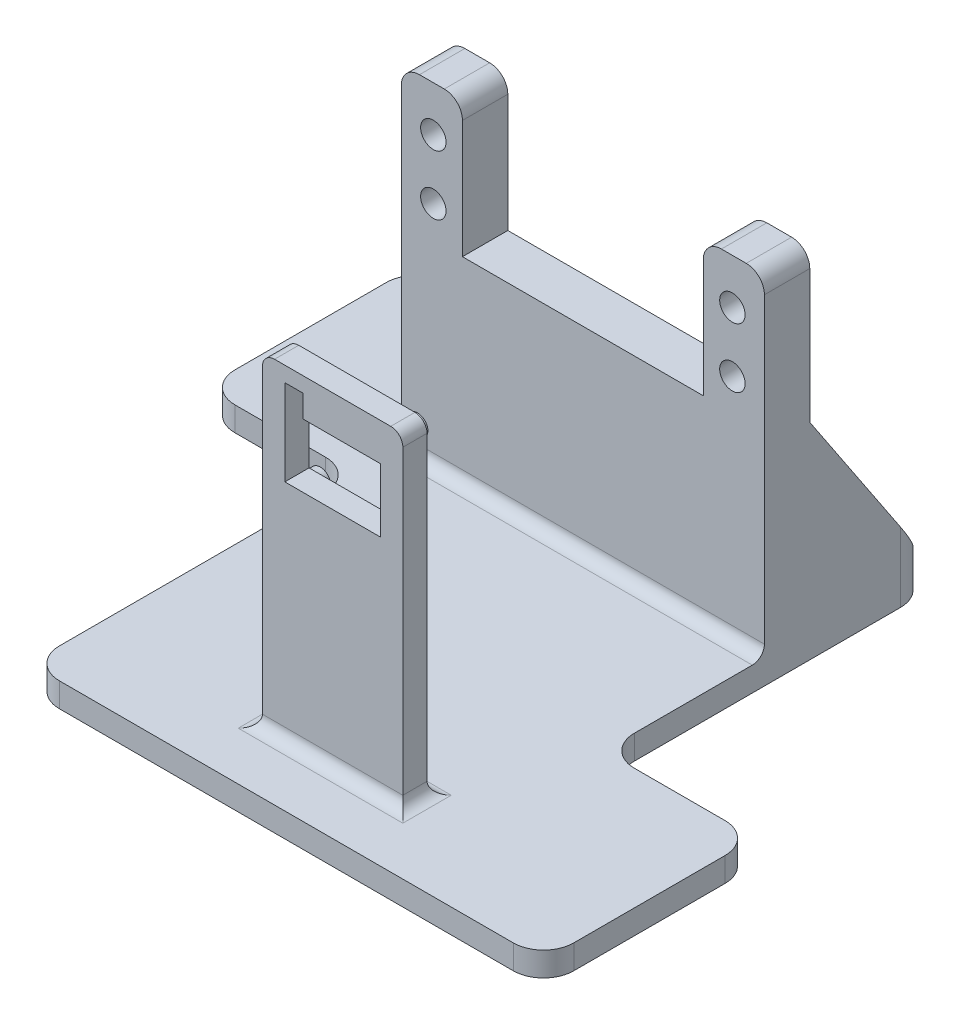
from build123d import *

# Parameters (mm, degrees)
SKETCH2_W                = 60
SKETCH2_H                = 55
BOSS_EXTRUDE1_DEPTH      = 7.5
SKETCH3_W                = 39.8
SKETCH3_H                = 45
CUT_EXTRUDE1_DEPTH       = 42.382363393
SKETCH4_R                = 2.1
CUT_EXTRUDE2_DEPTH       = 42.382363393
BOSS_EXTRUDE2_DEPTH      = 3
BOSS_EXTRUDE2_DEPTH_BACK = 1
SKETCH6_R                = 1.7
SKETCH6_W                = 15.8
SKETCH6_H                = 10.5
SKETCH7_W                = 3
SKETCH7_H                = 3.7
CUT_EXTRUDE3_DEPTH       = 4
SKETCH8_R                = 1.7
BOSS_EXTRUDE4_DEPTH      = 6
SKETCH10_W               = 60
SKETCH10_H               = 89
BOSS_EXTRUDE5_DEPTH      = 4
BOSS_EXTRUDE6_DEPTH      = 4
LPATTERN1_COUNT          = 2
LPATTERN1_PITCH          = 56
FILLET1_R                = 3
FILLET3_R                = 2
FILLET4_R                = 2
FILLET5_R                = 2
FILLET6_R                = 2
FILLET7_R                = 2
FILLET8_R                = 2
FILLET9_R                = 2
FILLET10_R               = 2
SKETCH12_W               = 25
SKETCH12_H               = 35
BOSS_EXTRUDE7_DEPTH      = 4
FILLET11_R               = 5


with BuildPart() as part:
    # Sketch2 → Boss-Extrude1 (new body)
    with BuildSketch(Plane.XY):
        Rectangle(SKETCH2_W, SKETCH2_H)
    extrude(amount=BOSS_EXTRUDE1_DEPTH)

    # Sketch3 → Cut-Extrude1 (cut, through all)
    with BuildSketch(Plane.XY.offset(7.5)):
        with Locations((0, 27.5)):
            Rectangle(SKETCH3_W, SKETCH3_H)
    extrude(amount=-CUT_EXTRUDE1_DEPTH, mode=Mode.SUBTRACT)

    # Sketch4 → Cut-Extrude2 (cut, through all)
    with BuildSketch(Plane.XY.offset(7.5)):
        with Locations((-24.71, 20.03)):
            Circle(SKETCH4_R)
        with Locations((-24.71, 10.18)):
            Circle(SKETCH4_R)
        with Locations(Location((24.71, 20.03, 0), (0, 0, 180))):
            Circle(SKETCH4_R)
        with Locations(Location((24.71, 10.18, 0), (0, 0, 180))):
            Circle(SKETCH4_R)
    extrude(amount=-CUT_EXTRUDE2_DEPTH, mode=Mode.SUBTRACT)



with BuildPart() as body_2:
    # Sketch6 → Boss-Extrude2 (new, two sides: drawn at the far end of the back side and taken through both)
    with BuildSketch(Plane.XY.offset(56).offset(-BOSS_EXTRUDE2_DEPTH_BACK)):
        Polygon((-1.45, 3.4), (-1.45, 26.3), (21.75, 26.3), (21.75, 3.4), (21.75, -27.5), (-1.45, -27.5), align=None)
        with Locations((18.194, 22.744)):
            Circle(SKETCH6_R, mode=Mode.SUBTRACT)
        with Locations((2.11, 6.956)):
            Circle(SKETCH6_R, mode=Mode.SUBTRACT)
        with Locations((10.15, 14.85)):
            Rectangle(SKETCH6_W, SKETCH6_H, mode=Mode.SUBTRACT)
    extrude(amount=BOSS_EXTRUDE2_DEPTH + BOSS_EXTRUDE2_DEPTH_BACK)

    # Sketch7 → Cut-Extrude3 (cut)
    with BuildSketch(Plane.XY.offset(59)):
        with Locations((3.75, 21.95)):
            Rectangle(SKETCH7_W, SKETCH7_H)
    extrude(amount=-CUT_EXTRUDE3_DEPTH, mode=Mode.SUBTRACT)

    # Sketch8 → Boss-Extrude4 (add)
    with BuildSketch(Plane.XY.offset(59)):
        with Locations((18.194, 22.744)):
            Circle(SKETCH8_R)
        with Locations((2.11, 6.956)):
            Circle(SKETCH8_R)
    extrude(amount=-BOSS_EXTRUDE4_DEPTH)


with BuildPart() as part_1:
    add(part.part)

    add(body_2.part)  # Boss-Extrude5 merges body 2
    # Sketch10 → Boss-Extrude5 (add)
    with BuildSketch(Plane.XZ.offset(27.5)):
        with Locations((0, 24.5)):
            Rectangle(SKETCH10_W, SKETCH10_H)
    extrude(amount=BOSS_EXTRUDE5_DEPTH)

    # Sketch11 → Boss-Extrude6 (add)
    with BuildSketch(Plane(origin=(30, 0, 0), x_dir=(0, 0, -1), z_dir=(1, 0, 0))):
        Polygon((0, 2.5), (20, -27.5), (0, -27.5), align=None)
    boss_extrude6 = extrude(amount=-BOSS_EXTRUDE6_DEPTH)

    # LPattern1: Boss-Extrude6 ×2
    with Locations(*[(-i * LPATTERN1_PITCH, 0, 0) for i in range(1, LPATTERN1_COUNT)]):
        add(boss_extrude6)

    # Fillet1
    fillet1_edges = [part_1.edges().sort_by_distance(p)[0] for p in [
        (19.9, 27.5, 3.75),
        (-19.9, 27.5, 3.75),
        (-30, 27.5, 3.75),
        (30, 27.5, 3.75),
    ]]
    fillet(fillet1_edges, radius=FILLET1_R)

    # Fillet3
    fillet3_edges = [part_1.edges().sort_by_distance(p)[0] for p in [
        (21.75, 26.3, 57),
        (-1.45, 26.3, 57),
    ]]
    fillet(fillet3_edges, radius=FILLET3_R)

    # Fillet4
    fillet4_edges = [part_1.edges().sort_by_distance(p)[0] for p in [
        (-1.45, -27.5, 57),
    ]]
    fillet(fillet4_edges, radius=FILLET4_R)

    # Fillet5
    fillet5_edges = [part_1.edges().sort_by_distance(p)[0] for p in [
        (21.75, -27.5, 57),
    ]]
    fillet(fillet5_edges, radius=FILLET5_R)

    # Fillet6
    fillet6_edges = [part_1.edges().sort_by_distance(p)[0] for p in [
        (0, -27.5, 7.5),
    ]]
    fillet(fillet6_edges, radius=FILLET6_R)

    # Fillet7
    fillet7_edges = [part_1.edges().sort_by_distance(p)[0] for p in [
        (10.15, -27.5, 55),
    ]]
    fillet(fillet7_edges, radius=FILLET7_R)

    # Fillet8
    fillet8_edges = [part_1.edges().sort_by_distance(p)[0] for p in [
        (10.15, -27.5, 59),
    ]]
    fillet(fillet8_edges, radius=FILLET8_R)

    # Fillet9
    fillet9_edges = [part_1.edges().sort_by_distance(p)[0] for p in [
        (26, -12.5, 0),
    ]]
    fillet(fillet9_edges, radius=FILLET9_R)

    # Fillet10
    fillet10_edges = [part_1.edges().sort_by_distance(p)[0] for p in [
        (-26, -12.5, 0),
    ]]
    fillet(fillet10_edges, radius=FILLET10_R)

    # Sketch12 → Boss-Extrude7 (add)
    with BuildSketch(Plane.XZ.offset(31.5)):
        with Locations((-42.5, -2.5)):
            Rectangle(SKETCH12_W, SKETCH12_H)
        with Locations((42.5, 51.5)):
            Rectangle(SKETCH12_W, SKETCH12_H)
    extrude(amount=-BOSS_EXTRUDE7_DEPTH)

    # Fillet11
    # the kernel refuses this fillet: 5 mm, written as the material it adds along each edge
    with BuildSketch(Plane(origin=(-30, -31.5, 15), x_dir=(-1, 0, 0), z_dir=(0, 1, 0)), Plane(origin=(30, -31.5, 34), x_dir=(1, 0, 0), z_dir=(0, 1, 0))) as fillet11_piece_1:
        with BuildLine():
            CenterArc((FILLET11_R, FILLET11_R), FILLET11_R, 180, 90)
            Line((0, FILLET11_R), (0, 0))
            Line((0, 0), (FILLET11_R, 0))
        make_face()
    extrude(amount=4)
    # the kernel refuses this fillet: 5 mm, written as the material it takes off along each edge
    with BuildSketch(Plane(origin=(-55, -44, 15), x_dir=(0, 0, -1), z_dir=(0, 1, 0)), Plane(origin=(-55, -44, -20), x_dir=(1, 0, 0), z_dir=(0, 1, 0)), Plane(origin=(30, -15, -20), x_dir=(-1, 0, 0), z_dir=(0, -1, 0))) as fillet11_2_piece_1:
        with BuildLine():
            CenterArc((FILLET11_R, -FILLET11_R), FILLET11_R, 90, 90)
            Line((0, -FILLET11_R), (0, 0))
            Line((0, 0), (FILLET11_R, 0))
        make_face()
    extrude(amount=29, mode=Mode.SUBTRACT)
    with BuildSketch(Plane(origin=(55, -44, 34), x_dir=(-1, 0, 0), z_dir=(0, 1, 0)), Plane(origin=(55, -44, 69), x_dir=(0, 0, -1), z_dir=(0, 1, 0)), Plane(origin=(-30, -15, 69), x_dir=(0, 0, -1), z_dir=(0, -1, 0))) as fillet11_2_piece_2:
        with BuildLine():
            CenterArc((FILLET11_R, FILLET11_R), FILLET11_R, 180, 90)
            Line((0, FILLET11_R), (0, 0))
            Line((0, 0), (FILLET11_R, 0))
        make_face()
    extrude(amount=29, mode=Mode.SUBTRACT)


solid = part_1.part
